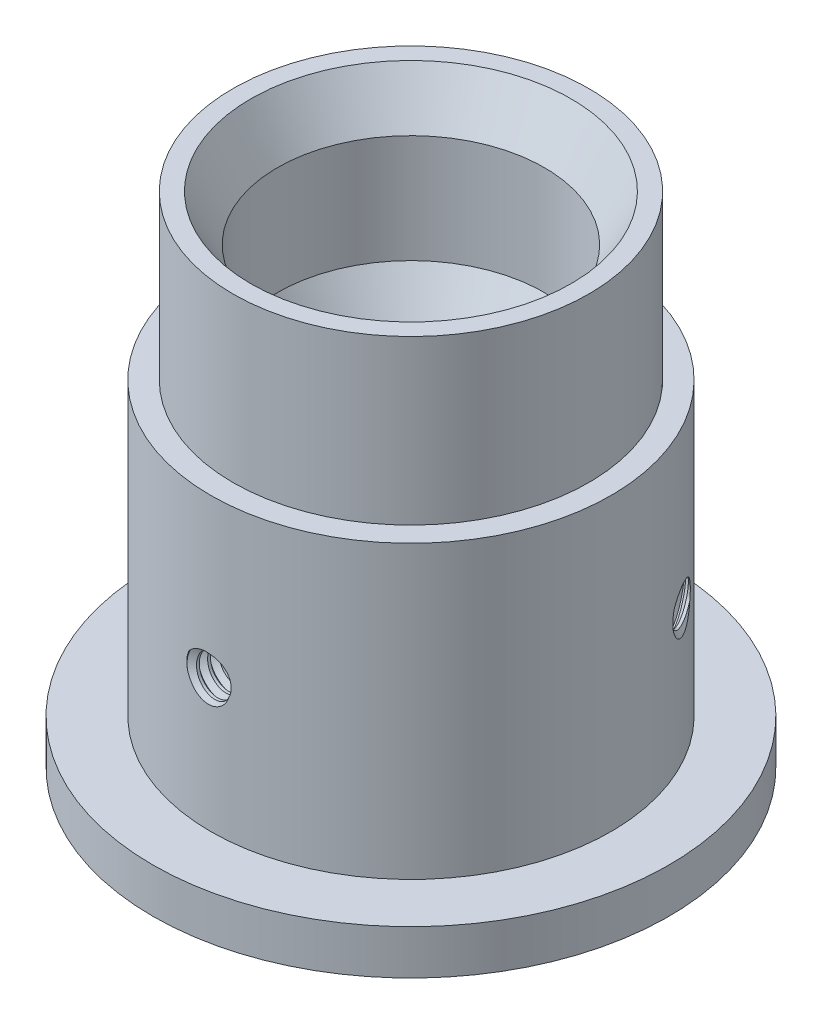
from build123d import *

# Parameters (mm, degrees)
SKETCH2_R          = 1.397
CUT_EXTRUDE1_DEPTH = 36.917483618
THREAD1_PITCH      = 0.79375
CIRPATTERN2_COUNT  = 3


with BuildPart() as part:
    # Sketch1 → Revolve1 (revolve)
    with BuildSketch(Plane.XY, mode=Mode.PRIVATE) as revolve1_sk:
        Polygon((7.3025, -2.621451257), (7.3025, -21.383696344), (5.912297817, -21.383696344), (6.624729433, -24.735423576), (11.818131872, -24.735423576), (11.818131872, -23.355987538), (18.415, -23.355987538), (18.415, -20.180987538), (14.2875, -20.180987538), (14.2875, 0.594009513), (12.7, 0.594009513), (12.7, 12.248538451), (11.43, 12.248538451), (9.525, 8.948981662), (9.525, 1.228031662), align=None)
    revolve(revolve1_sk.sketch.rotate(Axis((0, 0, 0), (0, -1, 0)), 90), axis=Axis((0, 0, 0), (0, -1, 0)))

    # Sketch2 → Cut-Extrude1 (cut, through all)
    with BuildSketch(Plane.XY):
        with Locations(Location((0, -10.655987538, 0), (0, 0, 270))):
            Circle(SKETCH2_R)
    cut_extrude1 = extrude(amount=CUT_EXTRUDE1_DEPTH, mode=Mode.SUBTRACT)

    # Thread1: the profile of Thread Profile1 profile screwed along a right-hand helix of 19.259843 turns, 8 arcs to a turn; built about Z, then put on its axis
    thread1_z = Axis((0, 0, 0), (0, 0, 1))
    thread1_corners = [(1.3967, 0, -0.000173205), (1.826629788, 0, 0.248046874), (1.826629788, 0, 0.347265624), (1.3967, 0, 0.595485703)]
    with BuildLine(mode=Mode.PRIVATE) as thread1_profile:
        Line(thread1_corners[0], thread1_corners[1])
        Line(thread1_corners[1], thread1_corners[2])
        Line(thread1_corners[2], thread1_corners[3])
        Line(thread1_corners[3], thread1_corners[0])
    thread1_cap = Face(thread1_profile.wire())
    thread1_turn_angles = [0, 22.5, 45, 67.5, 90, 112.5, 135, 157.5, 180, 202.5, 225, 247.5, 270, 292.5, 315, 337.5, 360]
    thread1_turn_weights = [1, 0.9238795325112867, 1, 0.9238795325112867, 1, 0.9238795325112867, 1, 0.9238795325112867, 1, 0.9238795325112867, 1, 0.9238795325112867, 1, 0.9238795325112867, 1, 0.9238795325112867, 1]
    thread1_turn_rails = [Edge.make_bspline([Vector(p[0], p[1], 0).rotate(thread1_z, thread1_turn_angles[k]) / thread1_turn_weights[k] + Vector(0, 0, p[2] + THREAD1_PITCH * thread1_turn_angles[k] / 360) for k in range(17)], [0, 0, 0, 1, 1, 2, 2, 3, 3, 4, 4, 5, 5, 6, 6, 7, 7, 8, 8, 8], 2, thread1_turn_weights) for p in thread1_corners]
    thread1_turn_sides = [Face.make_surface_from_curves(thread1_turn_rails[p[0]], thread1_turn_rails[p[1]]) for p in [(0, 1), (1, 2), (2, 3), (3, 0)]]
    thread1_last_angles = [6840, 6862.5, 6885, 6907.5, 6930, 6931.771653543, 6933.543307087]
    thread1_last_weights = [1, 0.9238795325112867, 1, 0.9238795325112867, 1, 0.9995219781697027, 1]
    thread1_last_rails = [Edge.make_bspline([Vector(p[0], p[1], 0).rotate(thread1_z, thread1_last_angles[k]) / thread1_last_weights[k] + Vector(0, 0, p[2] + THREAD1_PITCH * thread1_last_angles[k] / 360) for k in range(7)], [0, 0, 0, 1, 1, 2, 2, 3, 3, 3], 2, thread1_last_weights) for p in thread1_corners]
    thread1_last_sides = [Face.make_surface_from_curves(thread1_last_rails[p[0]], thread1_last_rails[p[1]]) for p in [(0, 1), (1, 2), (2, 3), (3, 0)]]
    thread1 = Plane(origin=(0, -10.655987538, 15.2875), x_dir=(-1, 0, 0), z_dir=(0, 0, -1)) * Solid(Shell([*[p.moved(Location((0, 0, THREAD1_PITCH * i))) for i in range(19) for p in thread1_turn_sides], *thread1_last_sides, thread1_cap, thread1_cap.rotate(thread1_z, 6933.543307087).moved(Location((0, 0, THREAD1_PITCH * 6933.543307087 / 360)))]))
    add(thread1, mode=Mode.SUBTRACT)

    # CirPattern2: Cut-Extrude1, Thread1 ×3 about axis
    cirpattern2_axis = Axis((0, 0, 0), (0, 1, 0))
    add([cut_extrude1.rotate(cirpattern2_axis, i * 360 / CIRPATTERN2_COUNT) for i in range(1, CIRPATTERN2_COUNT)], mode=Mode.SUBTRACT)
    add([thread1.rotate(cirpattern2_axis, i * 360 / CIRPATTERN2_COUNT) for i in range(1, CIRPATTERN2_COUNT)], mode=Mode.SUBTRACT)


solid = part.part
